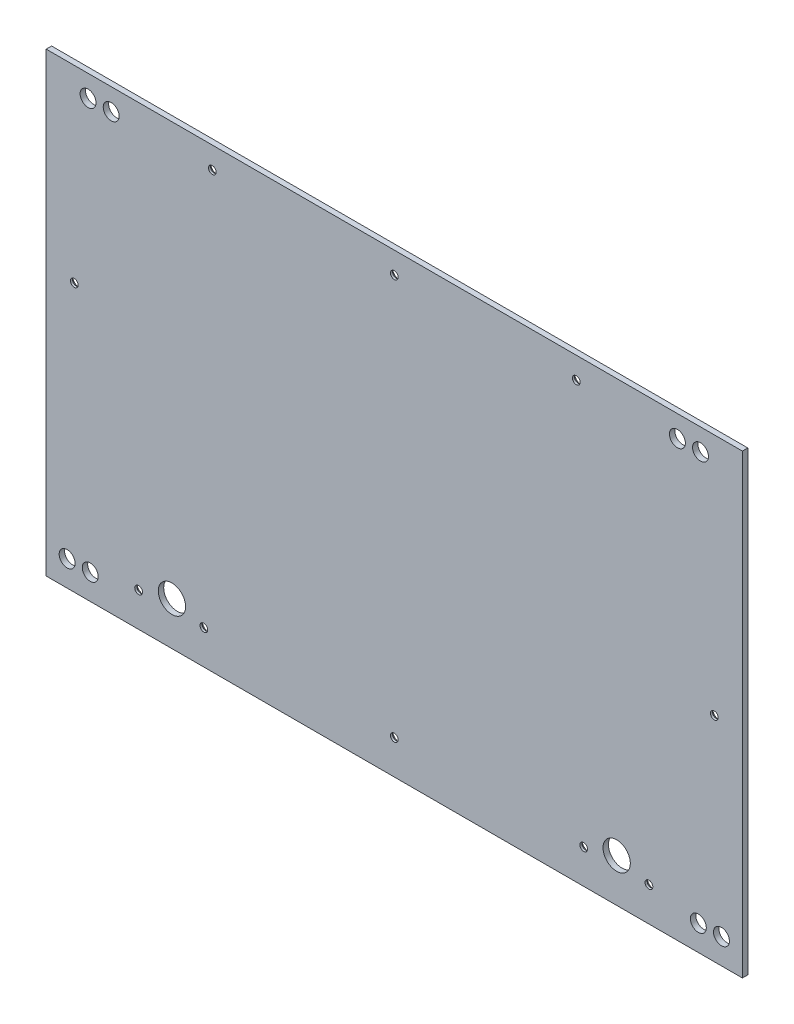
from build123d import *

# Parameters (mm, degrees)
SKETCH1_W                                      = 306.05
SKETCH1_H                                      = 197.425
BOSS_EXTRUDE1_DEPTH                            = 2.38125
SKETCH9_W                                      = 306.05
SKETCH9_H                                      = 2.38125
BOSS_EXTRUDE2_DEPTH                            = 3.175
SKETCH10_R                                     = 3.5
CUT_EXTRUDE1_DEPTH                             = 184.856965146
CSK_FOR_M3_FLAT_HEAD_MACHINE_SCREW1_AT_2_COUNT = 2
CSK_FOR_M3_FLAT_HEAD_MACHINE_SCREW1_AT_2_PITCH = 28.69
CSK_FOR_M3_FLAT_HEAD_MACHINE_SCREW1_AT_3_COUNT = 2
CSK_FOR_M3_FLAT_HEAD_MACHINE_SCREW1_AT_3_PITCH = 83.856540491
CSK_FOR_M3_FLAT_HEAD_MACHINE_SCREW1_AT_4_COUNT = 2
CSK_FOR_M3_FLAT_HEAD_MACHINE_SCREW1_AT_4_PITCH = 178.948509983
CSK_FOR_M3_FLAT_HEAD_MACHINE_SCREW1_AT_5_COUNT = 2
CSK_FOR_M3_FLAT_HEAD_MACHINE_SCREW1_AT_5_PITCH = 208.645558843
CSK_FOR_M3_FLAT_HEAD_MACHINE_SCREW1_AT_6_COUNT = 2
CSK_FOR_M3_FLAT_HEAD_MACHINE_SCREW1_AT_6_PITCH = 260.467597265
CSK_FOR_M3_FLAT_HEAD_MACHINE_SCREW1_AT_7_COUNT = 2
CSK_FOR_M3_FLAT_HEAD_MACHINE_SCREW1_AT_7_PITCH = 272.733119364
CSK_FOR_M3_FLAT_HEAD_MACHINE_SCREW1_AT_8_COUNT = 2
CSK_FOR_M3_FLAT_HEAD_MACHINE_SCREW1_AT_8_PITCH = 224.342
CSK_FOR_M3_FLAT_HEAD_MACHINE_SCREW1_AT_9_COUNT = 2
CSK_FOR_M3_FLAT_HEAD_MACHINE_SCREW1_AT_9_PITCH = 195.652
CSK_FOR_M3_FLAT_HEAD_MACHINE_SCREW1_AT_1_COUNT = 2
CSK_FOR_M3_FLAT_HEAD_MACHINE_SCREW1_AT_1_PITCH = 111.94
SKETCH13_R                                     = 5.999999997
CUT_EXTRUDE2_DEPTH                             = 184.856965146


with BuildPart() as part:
    # Sketch1 → Boss-Extrude1 (new body)
    with BuildSketch(Plane.XY):
        Rectangle(SKETCH1_W, SKETCH1_H)
    extrude(amount=BOSS_EXTRUDE1_DEPTH)

    # Sketch9 → Boss-Extrude2 (add)
    with BuildSketch(Plane(origin=(0, 98.7125, 0), x_dir=(1, 0, 0), z_dir=(0, 1, 0))):
        with Locations((0, -1.190625)):
            Rectangle(SKETCH9_W, SKETCH9_H)
    extrude(amount=BOSS_EXTRUDE2_DEPTH)

    # Sketch10 → Cut-Extrude1 (cut, through all)
    with BuildSketch(Plane(origin=(0, 0, 0), x_dir=(-1, 0, 0), z_dir=(0, 0, -1))):
        with Locations((-134.610000066, 92.362499989)):
            Circle(SKETCH10_R)
        with Locations((-124.450000066, 92.362499989)):
            Circle(SKETCH10_R)
        with Locations((-143.817500066, -87.537500111)):
            Circle(SKETCH10_R)
        with Locations((-133.657500066, -87.537500111)):
            Circle(SKETCH10_R)
    cut_extrude1 = extrude(amount=-CUT_EXTRUDE1_DEPTH, mode=Mode.SUBTRACT)

    # Mirror1: Cut-Extrude1 across plane
    add(cut_extrude1.mirror(Plane(origin=(0, 0, 0), x_dir=(0, 0, 1), z_dir=(1, 0, 0))), mode=Mode.SUBTRACT)

    # Sketch12 → CSK for M3 Flat Head Machine Screw1 (revolve, cut)
    with BuildSketch(Plane(origin=(111.94, -83.7125, 0), x_dir=(0, 1, 0), z_dir=(1, 0, 0))):
        Polygon((0, 0), (0, 2.38125), (1.7, 2.38125), (1.7, 1.45), (3.15, 0), align=None)
    csk_for_m3_flat_head_machine_screw1 = revolve(axis=Axis((111.94, -83.7125, -6.35), (0, 0, 1)), mode=Mode.SUBTRACT)

    # CSK for M3 Flat Head Machine Screw1 at 2: CSK for M3 Flat Head Machine Screw1 ×2
    with Locations(*[(-i * CSK_FOR_M3_FLAT_HEAD_MACHINE_SCREW1_AT_2_PITCH, 0, 0) for i in range(1, CSK_FOR_M3_FLAT_HEAD_MACHINE_SCREW1_AT_2_COUNT)]):
        add(csk_for_m3_flat_head_machine_screw1, mode=Mode.SUBTRACT)

    # CSK for M3 Flat Head Machine Screw1 at 3: CSK for M3 Flat Head Machine Screw1 ×2
    with Locations(*[Vector(0.34281762477474764, 0.9394019779326636, 0) * (i * CSK_FOR_M3_FLAT_HEAD_MACHINE_SCREW1_AT_3_PITCH) for i in range(1, CSK_FOR_M3_FLAT_HEAD_MACHINE_SCREW1_AT_3_COUNT)]):
        add(csk_for_m3_flat_head_machine_screw1, mode=Mode.SUBTRACT)

    # CSK for M3 Flat Head Machine Screw1 at 4: CSK for M3 Flat Head Machine Screw1 ×2
    with Locations(*[Vector(-0.17848709666882537, 0.9839422525345344, 0) * (i * CSK_FOR_M3_FLAT_HEAD_MACHINE_SCREW1_AT_4_PITCH) for i in range(1, CSK_FOR_M3_FLAT_HEAD_MACHINE_SCREW1_AT_4_COUNT)]):
        add(csk_for_m3_flat_head_machine_screw1, mode=Mode.SUBTRACT)

    # CSK for M3 Flat Head Machine Screw1 at 5: CSK for M3 Flat Head Machine Screw1 ×2
    with Locations(*[Vector(-0.5365079449598532, 0.8438952689729663, 0) * (i * CSK_FOR_M3_FLAT_HEAD_MACHINE_SCREW1_AT_5_PITCH) for i in range(1, CSK_FOR_M3_FLAT_HEAD_MACHINE_SCREW1_AT_5_COUNT)]):
        add(csk_for_m3_flat_head_machine_screw1, mode=Mode.SUBTRACT)

    # CSK for M3 Flat Head Machine Screw1 at 6: CSK for M3 Flat Head Machine Screw1 ×2
    with Locations(*[Vector(-0.7369054808176366, 0.6759957931384839, 0) * (i * CSK_FOR_M3_FLAT_HEAD_MACHINE_SCREW1_AT_6_PITCH) for i in range(1, CSK_FOR_M3_FLAT_HEAD_MACHINE_SCREW1_AT_6_COUNT)]):
        add(csk_for_m3_flat_head_machine_screw1, mode=Mode.SUBTRACT)

    # CSK for M3 Flat Head Machine Screw1 at 7: CSK for M3 Flat Head Machine Screw1 ×2
    with Locations(*[Vector(-0.9262809761508288, 0.37683358823367613, 0) * (i * CSK_FOR_M3_FLAT_HEAD_MACHINE_SCREW1_AT_7_PITCH) for i in range(1, CSK_FOR_M3_FLAT_HEAD_MACHINE_SCREW1_AT_7_COUNT)]):
        add(csk_for_m3_flat_head_machine_screw1, mode=Mode.SUBTRACT)

    # CSK for M3 Flat Head Machine Screw1 at 8: CSK for M3 Flat Head Machine Screw1 ×2
    with Locations(*[(-i * CSK_FOR_M3_FLAT_HEAD_MACHINE_SCREW1_AT_8_PITCH, 0, 0) for i in range(1, CSK_FOR_M3_FLAT_HEAD_MACHINE_SCREW1_AT_8_COUNT)]):
        add(csk_for_m3_flat_head_machine_screw1, mode=Mode.SUBTRACT)

    # CSK for M3 Flat Head Machine Screw1 at 9: CSK for M3 Flat Head Machine Screw1 ×2
    with Locations(*[(-i * CSK_FOR_M3_FLAT_HEAD_MACHINE_SCREW1_AT_9_PITCH, 0, 0) for i in range(1, CSK_FOR_M3_FLAT_HEAD_MACHINE_SCREW1_AT_9_COUNT)]):
        add(csk_for_m3_flat_head_machine_screw1, mode=Mode.SUBTRACT)

    # CSK for M3 Flat Head Machine Screw1 at 1: CSK for M3 Flat Head Machine Screw1 ×2
    with Locations(*[(-i * CSK_FOR_M3_FLAT_HEAD_MACHINE_SCREW1_AT_1_PITCH, 0, 0) for i in range(1, CSK_FOR_M3_FLAT_HEAD_MACHINE_SCREW1_AT_1_COUNT)]):
        add(csk_for_m3_flat_head_machine_screw1, mode=Mode.SUBTRACT)

    # Sketch13 → Cut-Extrude2 (cut, through all)
    with BuildSketch(Plane(origin=(0, 0, 0), x_dir=(-1, 0, 0), z_dir=(0, 0, -1))):
        with Locations((-97.75, -79.7125001)):
            Circle(SKETCH13_R)
        with Locations((97.75, -79.7125001)):
            Circle(SKETCH13_R)
    extrude(amount=-CUT_EXTRUDE2_DEPTH, mode=Mode.SUBTRACT)


solid = part.part
